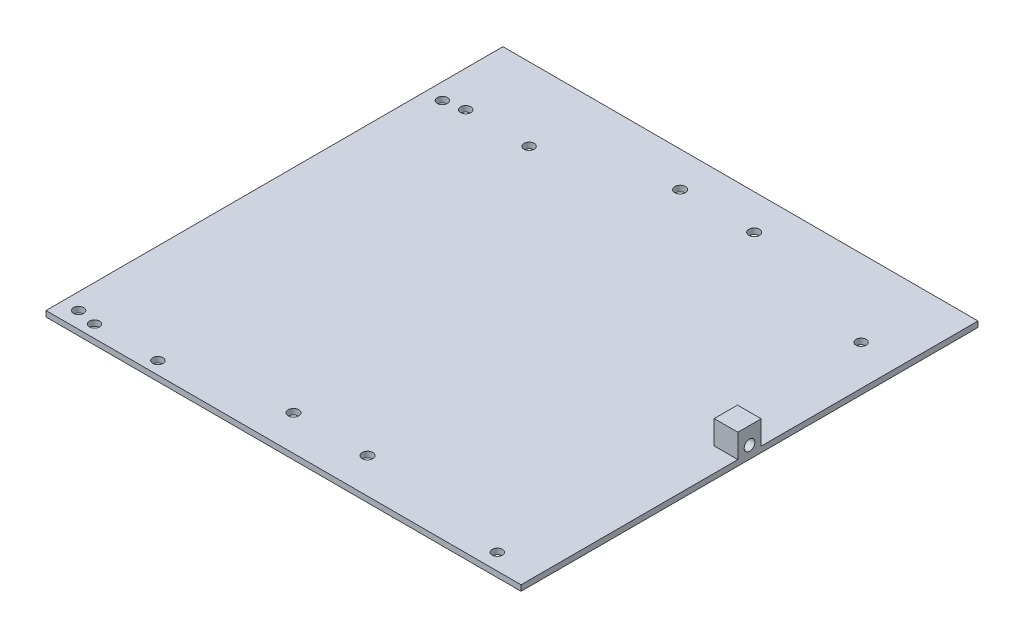
from build123d import *

# Parameters (mm, degrees)
SKETCH1_W           = 101.879999948
SKETCH1_H           = 98
BOSS_EXTRUDE1_DEPTH = 1.2192
CUT_EXTRUDE1_REACH  = 143.368
SKETCH5_R           = 1.0922
CUT_EXTRUDE2_REACH  = 143.368
SKETCH6_R           = 1.143
SKETCH10_W          = 5
SKETCH10_H          = 5.08
SKETCH10_R          = 1.143
BOSS_EXTRUDE2_DEPTH = 5.08


with BuildPart() as part:
    # Sketch1 → Boss-Extrude1 (new body)
    with BuildSketch(Plane(origin=(0, 0, 0), x_dir=(1, 0, 0), z_dir=(0, 1, 0))):
        with Locations((50.939999974, -49)):
            Rectangle(SKETCH1_W, SKETCH1_H)
    extrude(amount=BOSS_EXTRUDE1_DEPTH)

    # Sketch5 → Cut-Extrude1 (cut, up to next)
    with BuildSketch(Plane(origin=(0, 0, 0), x_dir=(-1, 0, 0), z_dir=(0, -1, 0)), mode=Mode.PRIVATE) as cut_extrude1_sk1:
        with Locations((-3.5, -94.5)):
            Circle(SKETCH5_R)
    cut_extrude1_tool1 = extrude(cut_extrude1_sk1.sketch, amount=-CUT_EXTRUDE1_REACH, mode=Mode.PRIVATE) & part.part
    # Sketch5 → Cut-Extrude1 (cut, up to next)
    with BuildSketch(Plane(origin=(0, 0, 0), x_dir=(-1, 0, 0), z_dir=(0, -1, 0)), mode=Mode.PRIVATE) as cut_extrude1_sk2:
        with Locations((-7.7, -95.3)):
            Circle(SKETCH5_R)
    cut_extrude1_tool2 = extrude(cut_extrude1_sk2.sketch, amount=-CUT_EXTRUDE1_REACH, mode=Mode.PRIVATE) & part.part
    # Sketch5 → Cut-Extrude1 (cut, up to next)
    with BuildSketch(Plane(origin=(0, 0, 0), x_dir=(-1, 0, 0), z_dir=(0, -1, 0)), mode=Mode.PRIVATE) as cut_extrude1_sk3:
        with Locations((-21.3, -95.3)):
            Circle(SKETCH5_R)
    cut_extrude1_tool3 = extrude(cut_extrude1_sk3.sketch, amount=-CUT_EXTRUDE1_REACH, mode=Mode.PRIVATE) & part.part
    # Sketch5 → Cut-Extrude1 (cut, up to next)
    with BuildSketch(Plane(origin=(0, 0, 0), x_dir=(-1, 0, 0), z_dir=(0, -1, 0)), mode=Mode.PRIVATE) as cut_extrude1_sk4:
        with Locations((-93.3, -94.5)):
            Circle(SKETCH5_R)
    cut_extrude1_tool4 = extrude(cut_extrude1_sk4.sketch, amount=-CUT_EXTRUDE1_REACH, mode=Mode.PRIVATE) & part.part
    # Sketch5 → Cut-Extrude1 (cut, up to next)
    with BuildSketch(Plane(origin=(0, 0, 0), x_dir=(-1, 0, 0), z_dir=(0, -1, 0)), mode=Mode.PRIVATE) as cut_extrude1_sk5:
        with Locations((-93.3, -16.5)):
            Circle(SKETCH5_R)
    cut_extrude1_tool5 = extrude(cut_extrude1_sk5.sketch, amount=-CUT_EXTRUDE1_REACH, mode=Mode.PRIVATE) & part.part
    # Sketch5 → Cut-Extrude1 (cut, up to next)
    with BuildSketch(Plane(origin=(0, 0, 0), x_dir=(-1, 0, 0), z_dir=(0, -1, 0)), mode=Mode.PRIVATE) as cut_extrude1_sk6:
        with Locations((-3.5, -16.5)):
            Circle(SKETCH5_R)
    cut_extrude1_tool6 = extrude(cut_extrude1_sk6.sketch, amount=-CUT_EXTRUDE1_REACH, mode=Mode.PRIVATE) & part.part
    # Sketch5 → Cut-Extrude1 (cut, up to next)
    with BuildSketch(Plane(origin=(0, 0, 0), x_dir=(-1, 0, 0), z_dir=(0, -1, 0)), mode=Mode.PRIVATE) as cut_extrude1_sk7:
        with Locations((-7.7, -15.7)):
            Circle(SKETCH5_R)
    cut_extrude1_tool7 = extrude(cut_extrude1_sk7.sketch, amount=-CUT_EXTRUDE1_REACH, mode=Mode.PRIVATE) & part.part
    # Sketch5 → Cut-Extrude1 (cut, up to next)
    with BuildSketch(Plane(origin=(0, 0, 0), x_dir=(-1, 0, 0), z_dir=(0, -1, 0)), mode=Mode.PRIVATE) as cut_extrude1_sk8:
        with Locations((-21.3, -15.7)):
            Circle(SKETCH5_R)
    cut_extrude1_tool8 = extrude(cut_extrude1_sk8.sketch, amount=-CUT_EXTRUDE1_REACH, mode=Mode.PRIVATE) & part.part
    add(cut_extrude1_tool1.solids().sort_by_distance((3.5, 0, 94.5))[0], mode=Mode.SUBTRACT)
    add(cut_extrude1_tool2.solids().sort_by_distance((7.7, 0, 95.3))[0], mode=Mode.SUBTRACT)
    add(cut_extrude1_tool3.solids().sort_by_distance((21.3, 0, 95.3))[0], mode=Mode.SUBTRACT)
    add(cut_extrude1_tool4.solids().sort_by_distance((93.3, 0, 94.5))[0], mode=Mode.SUBTRACT)
    add(cut_extrude1_tool5.solids().sort_by_distance((93.3, 0, 16.5))[0], mode=Mode.SUBTRACT)
    add(cut_extrude1_tool6.solids().sort_by_distance((3.5, 0, 16.5))[0], mode=Mode.SUBTRACT)
    add(cut_extrude1_tool7.solids().sort_by_distance((7.7, 0, 15.7))[0], mode=Mode.SUBTRACT)
    add(cut_extrude1_tool8.solids().sort_by_distance((21.3, 0, 15.7))[0], mode=Mode.SUBTRACT)

    # Sketch6 → Cut-Extrude2 (cut, up to next)
    with BuildSketch(Plane(origin=(0, 1.2192, 0), x_dir=(1, 0, 0), z_dir=(0, 1, 0)), mode=Mode.PRIVATE) as cut_extrude2_sk1:
        with Locations((61.417499948, -7.540625)):
            Circle(SKETCH6_R)
    cut_extrude2_tool1 = extrude(cut_extrude2_sk1.sketch, amount=-CUT_EXTRUDE2_REACH, mode=Mode.PRIVATE) & part.part
    # Sketch6 → Cut-Extrude2 (cut, up to next)
    with BuildSketch(Plane(origin=(0, 1.2192, 0), x_dir=(1, 0, 0), z_dir=(0, 1, 0)), mode=Mode.PRIVATE) as cut_extrude2_sk2:
        with Locations((45.542499948, -7.540625)):
            Circle(SKETCH6_R)
    cut_extrude2_tool2 = extrude(cut_extrude2_sk2.sketch, amount=-CUT_EXTRUDE2_REACH, mode=Mode.PRIVATE) & part.part
    # Sketch6 → Cut-Extrude2 (cut, up to next)
    with BuildSketch(Plane(origin=(0, 1.2192, 0), x_dir=(1, 0, 0), z_dir=(0, 1, 0)), mode=Mode.PRIVATE) as cut_extrude2_sk3:
        with Locations((45.542499948, -90.459375)):
            Circle(SKETCH6_R)
    cut_extrude2_tool3 = extrude(cut_extrude2_sk3.sketch, amount=-CUT_EXTRUDE2_REACH, mode=Mode.PRIVATE) & part.part
    # Sketch6 → Cut-Extrude2 (cut, up to next)
    with BuildSketch(Plane(origin=(0, 1.2192, 0), x_dir=(1, 0, 0), z_dir=(0, 1, 0)), mode=Mode.PRIVATE) as cut_extrude2_sk4:
        with Locations((61.417499948, -90.459375)):
            Circle(SKETCH6_R)
    cut_extrude2_tool4 = extrude(cut_extrude2_sk4.sketch, amount=-CUT_EXTRUDE2_REACH, mode=Mode.PRIVATE) & part.part
    add(cut_extrude2_tool1.solids().sort_by_distance((61.4175, 1.2192, 7.540625))[0], mode=Mode.SUBTRACT)
    add(cut_extrude2_tool2.solids().sort_by_distance((45.5425, 1.2192, 7.540625))[0], mode=Mode.SUBTRACT)
    add(cut_extrude2_tool3.solids().sort_by_distance((45.5425, 1.2192, 90.459375))[0], mode=Mode.SUBTRACT)
    add(cut_extrude2_tool4.solids().sort_by_distance((61.4175, 1.2192, 90.459375))[0], mode=Mode.SUBTRACT)

    # Sketch10 → Boss-Extrude2 (add)
    with BuildSketch(Plane(origin=(101.879999948, 0, 0), x_dir=(0, 0, -1), z_dir=(1, 0, 0))):
        with Locations((-49, 3.7592)):
            Rectangle(SKETCH10_W, SKETCH10_H)
        with Locations((-49, 2.64795)):
            Circle(SKETCH10_R, mode=Mode.SUBTRACT)
    extrude(amount=-BOSS_EXTRUDE2_DEPTH)


solid = part.part
